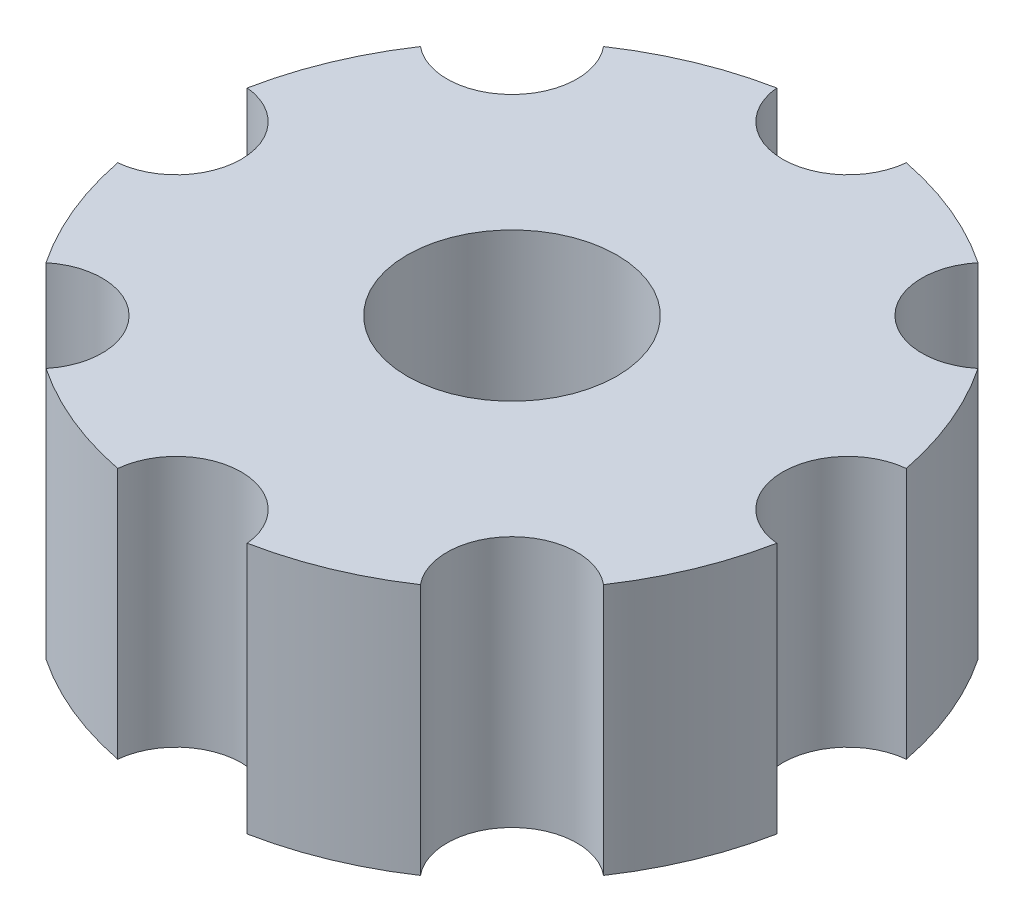
from build123d import *

# Parameters (mm, degrees)
SKETCH1_R           = 8
SKETCH1_R_2         = 2.5
BOSS_EXTRUDE1_DEPTH = 6
SKETCH1_3_R         = 2.5
BOSS_EXTRUDE2_DEPTH = 2
SKETCH1_4_R         = 1.55
CUT_EXTRUDE1_DEPTH  = 13.806248475
CIRPATTERN1_COUNT   = 8


with BuildPart() as part:
    # Sketch1 → Boss-Extrude1 (new body)
    with BuildSketch(Plane(origin=(0, 0, 0), x_dir=(1, 0, 0), z_dir=(0, 1, 0))):
        Circle(SKETCH1_R)
        Circle(SKETCH1_R_2, mode=Mode.SUBTRACT)
    extrude(amount=BOSS_EXTRUDE1_DEPTH)

    # Sketch1<3> → Boss-Extrude2 (add)
    with BuildSketch(Plane(origin=(0, 0, 0), x_dir=(1, 0, 0), z_dir=(0, 1, 0))):
        Circle(SKETCH1_3_R)
    extrude(amount=BOSS_EXTRUDE2_DEPTH)

    # Sketch1<4> → Cut-Extrude1 (cut, through all)
    with BuildSketch(Plane(origin=(0, 0, 0), x_dir=(1, 0, 0), z_dir=(0, 1, 0))):
        with Locations((0, 8)):
            Circle(SKETCH1_4_R)
    cut_extrude1 = extrude(amount=CUT_EXTRUDE1_DEPTH, mode=Mode.SUBTRACT)

    # CirPattern1: Cut-Extrude1 ×8 about axis
    cirpattern1_axis = Axis((0, 0, 0), (0, 1, 0))
    for i in range(1, CIRPATTERN1_COUNT):
        add(cut_extrude1.rotate(cirpattern1_axis, i * 360 / CIRPATTERN1_COUNT), mode=Mode.SUBTRACT)


solid = part.part
